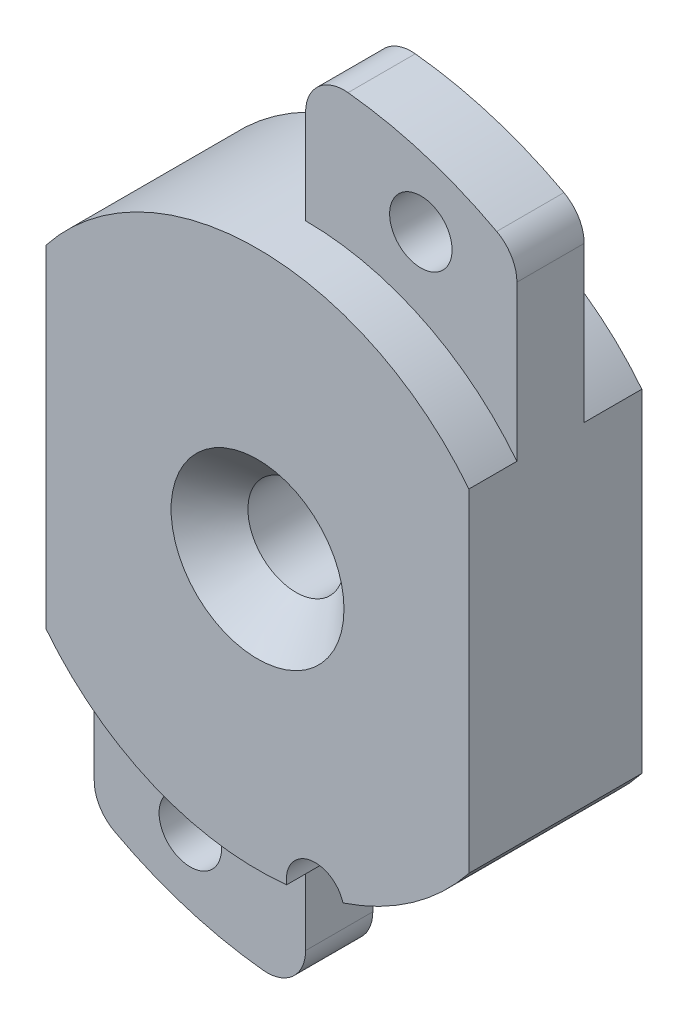
from build123d import *

# Parameters (mm, degrees)
SKETCH1_R           = 14
BOSS_EXTRUDE1_DEPTH = 9
SKETCH2_OUTSIDE_W   = 38.122
SKETCH2_OUTSIDE_H   = 38.122
SKETCH2_OUTSIDE_W_2 = 22
SKETCH2_OUTSIDE_H_2 = 28
CUT_EXTRUDE1_DEPTH  = 22.748563171
SKETCH3_R           = 2.5
CUT_EXTRUDE2_DEPTH  = 20.949937343
CHAMFER1_SIZE       = 2
BOSS_EXTRUDE2_START = 3
SKETCH4_W           = 11
SKETCH4_H           = 12.339745962
BOSS_EXTRUDE2_DEPTH = 3.5
SKETCH5_R           = 1.625
CUT_EXTRUDE3_DEPTH  = 26.357444666
CUT_EXTRUDE4_START  = 3
CUT_EXTRUDE4_DEPTH  = 3.5
CIRPATTERN1_COUNT   = 2
FILLET1_R           = 2
SKETCH7_R           = 1.5
CUT_EXTRUDE5_DEPTH  = 2.5


# Read off the part's stored shape, not the designer's step: Cut-Extrude4
with BuildPart() as part:
    # Sketch1 → Boss-Extrude1 (new body)
    with BuildSketch(Plane.XY):
        Circle(SKETCH1_R)
    extrude(amount=BOSS_EXTRUDE1_DEPTH)

    # Sketch2 outside → Cut-Extrude1 (cut, through all)
    with BuildSketch(Plane.XY):
        Rectangle(SKETCH2_OUTSIDE_W, SKETCH2_OUTSIDE_H)
        Rectangle(SKETCH2_OUTSIDE_W_2, SKETCH2_OUTSIDE_H_2, mode=Mode.SUBTRACT)
    extrude(amount=CUT_EXTRUDE1_DEPTH, mode=Mode.SUBTRACT)

    # Sketch3 → Cut-Extrude2 (cut, through all)
    with BuildSketch(Plane.XY.offset(9)):
        Circle(SKETCH3_R)
    extrude(amount=-CUT_EXTRUDE2_DEPTH, mode=Mode.SUBTRACT)

    # Chamfer1
    chamfer1_edges = [part.edges().sort_by_distance(p)[0] for p in [
        (-2.5, 0, 9),
    ]]
    chamfer(chamfer1_edges, length=CHAMFER1_SIZE)

    # Sketch4 → Boss-Extrude2 (add)
    with BuildSketch(Plane.XY.offset(BOSS_EXTRUDE2_START)):
        with Locations((5.5, 14.830127019)):
            Rectangle(SKETCH4_W, SKETCH4_H)
    boss_extrude2 = extrude(amount=BOSS_EXTRUDE2_DEPTH)

    # Sketch5 → Cut-Extrude3 (cut, through all)
    with BuildSketch(Plane.XY):
        with Locations((6, 16.5)):
            Circle(SKETCH5_R)
    cut_extrude3 = extrude(amount=CUT_EXTRUDE3_DEPTH, mode=Mode.SUBTRACT)

    # Cut-Extrude4 outline → Cut-Extrude4 (cut)
    with BuildSketch(Plane.XY.offset(CUT_EXTRUDE4_START)):
        with BuildLine():
            Line((11, 21), (0, 21))
            ThreePointArc((0, 21), (5.715793024, 20.20716977), (11, 17.88854382))
            Line((11, 17.88854382), (11, 21))
        make_face()
    cut_extrude4 = extrude(amount=CUT_EXTRUDE4_DEPTH, mode=Mode.SUBTRACT)

    # CirPattern1: Boss-Extrude2, Cut-Extrude3, Cut-Extrude4 ×2 about axis
    cirpattern1_axis = Axis((0, 0, 0), (0, 0, 1))
    add([boss_extrude2.rotate(cirpattern1_axis, i * 360 / CIRPATTERN1_COUNT) for i in range(1, CIRPATTERN1_COUNT)])
    add([cut_extrude3.rotate(cirpattern1_axis, i * 360 / CIRPATTERN1_COUNT) for i in range(1, CIRPATTERN1_COUNT)], mode=Mode.SUBTRACT)
    add([cut_extrude4.rotate(cirpattern1_axis, i * 360 / CIRPATTERN1_COUNT) for i in range(1, CIRPATTERN1_COUNT)], mode=Mode.SUBTRACT)

    # Fillet1
    fillet1_edges = [part.edges().sort_by_distance(p)[0] for p in [
        (-11, -17.88854382, 4.75),
        (0, 21, 4.75),
        (11, 17.88854382, 4.75),
        (0, -21, 4.75),
    ]]
    fillet(fillet1_edges, radius=FILLET1_R)

    # Sketch7 → Cut-Extrude5 (cut)
    with BuildSketch(Plane.XY.offset(9)):
        with Locations((3, -13.674794331)):
            Circle(SKETCH7_R)
    extrude(amount=-CUT_EXTRUDE5_DEPTH, mode=Mode.SUBTRACT)


solid = part.part
